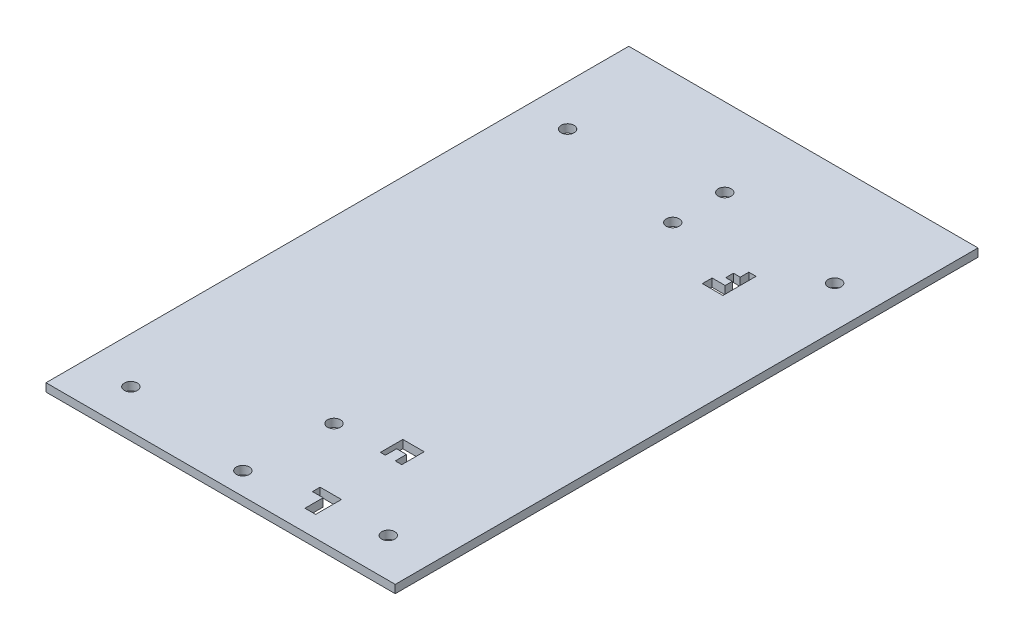
from build123d import *

# Parameters (mm, degrees)
SKETCH1_W           = 273.05
SKETCH1_H           = 455.6125
SKETCH1_R           = 5.08
BOSS_EXTRUDE1_DEPTH = 6.35


with BuildPart() as part:
    # Sketch1 → Boss-Extrude1 (new body)
    with BuildSketch(Plane(origin=(0, 0, 0), x_dir=(1, 0, 0), z_dir=(0, 1, 0))):
        with Locations((0, 101.290449082)):
            Rectangle(SKETCH1_W, SKETCH1_H)
        with Locations((-100.6380512, -96.068481922)):
            Circle(SKETCH1_R, mode=Mode.SUBTRACT)
        with Locations((100.6380512, -96.068481922)):
            Circle(SKETCH1_R, mode=Mode.SUBTRACT)
        with Locations((0, 226.966451634)):
            Circle(SKETCH1_R, mode=Mode.SUBTRACT)
        with Locations((0, 267.609461393)):
            Circle(SKETCH1_R, mode=Mode.SUBTRACT)
        with Locations((-104.394, 249.148548959)):
            Circle(SKETCH1_R, mode=Mode.SUBTRACT)
        with Locations((104.394, 249.148548959)):
            Circle(SKETCH1_R, mode=Mode.SUBTRACT)
        with Locations((3.666326597, -41.569496857)):
            Circle(SKETCH1_R, mode=Mode.SUBTRACT)
        with Locations((0, -109.13772467)):
            Circle(SKETCH1_R, mode=Mode.SUBTRACT)
        Polygon((69.012885603, 197.173617012), (52.948455079, 197.173617012), (52.948455079, 204.798194528), (63.135298998, 204.798194528), (63.135298998, 210.354654847), (58.041877039, 210.354654847), (58.041877039, 216.374153526), (63.366818178, 216.374153526), (63.366818178, 223.088209746), (69.012885603, 223.088209746), align=None, mode=Mode.SUBTRACT)
        Polygon((41.345742309, -42.951444708), (41.345742309, -25.410434465), (58.041877039, -25.410434465), (58.041877039, -42.951444708), (52.948455079, -42.951444708), (52.948455079, -34.180939586), (45.23941523, -34.180939586), (45.23941523, -42.951444708), align=None, mode=Mode.SUBTRACT)
        Polygon((58.041877039, -110.261456825), (58.041877039, -90.093932087), (41.345742309, -90.093932087), (41.345742309, -96.068481922), (49.693809674, -96.068481922), (49.693809674, -110.261456825), align=None, mode=Mode.SUBTRACT)
    extrude(amount=BOSS_EXTRUDE1_DEPTH)


solid = part.part
